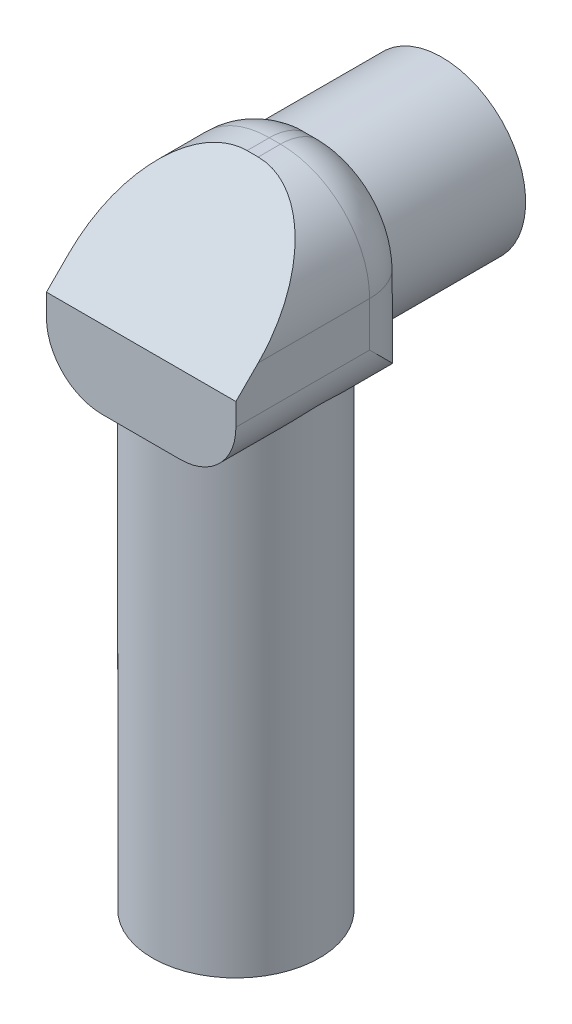
from build123d import *

# Parameters (mm, degrees)
SKETCH1_R           = 7.5
SKETCH1_R_2         = 2.4
BOSS_EXTRUDE1_DEPTH = 58
SKETCH2_W           = 17
SKETCH2_H           = 17
BOSS_EXTRUDE2_DEPTH = 17
SKETCH3_R           = 7.5
SKETCH3_R_2         = 2.4
BOSS_EXTRUDE3_DEPTH = 10
FILLET5_R           = 8
CHAMFER1_SIZE       = 10
FILLET4_R           = 5


with BuildPart() as part:
    # Sketch1 → Boss-Extrude1 (new body)
    with BuildSketch(Plane(origin=(0, 0, 0), x_dir=(1, 0, 0), z_dir=(0, 1, 0))):
        with Locations(Location((0, 0, 0), (0, 0, 90))):
            Circle(SKETCH1_R)
        with Locations(Location((0, 0, 0), (0, 0, 90))):
            Circle(SKETCH1_R_2, mode=Mode.SUBTRACT)
    extrude(amount=BOSS_EXTRUDE1_DEPTH)

    # Sketch2 → Boss-Extrude2 (add)
    with BuildSketch(Plane(origin=(0, 58, 0), x_dir=(1, 0, 0), z_dir=(0, 1, 0))):
        Rectangle(SKETCH2_W, SKETCH2_H)
    extrude(amount=-BOSS_EXTRUDE2_DEPTH)

    # Sketch3 → Boss-Extrude3 (add)
    with BuildSketch(Plane(origin=(0, 0, -8.5), x_dir=(-1, 0, 0), z_dir=(0, 0, -1))):
        with Locations((0, 49.5)):
            Circle(SKETCH3_R)
        with Locations((0, 49.5)):
            Circle(SKETCH3_R_2, mode=Mode.SUBTRACT)
    extrude(amount=BOSS_EXTRUDE3_DEPTH)

    # Fillet5
    fillet5_edges = [part.edges().sort_by_distance(p)[0] for p in [
        (8.5, 58, 0),
        (-8.5, 58, 0),
    ]]
    fillet(fillet5_edges, radius=FILLET5_R)

    # Chamfer1
    # the kernel refuses this chamfer: 10 mm, written as the material it takes off along each edge
    with BuildSketch(Plane(origin=(26.21682988, 58, 8.5), x_dir=(0, 0.027495876610586317, -0.9996219169112968), z_dir=(-1, 0, 0))) as chamfer1_piece_1:
        Polygon((CHAMFER1_SIZE * 0.999621916911, CHAMFER1_SIZE * 0.0274958766106), (-CHAMFER1_SIZE * 0.0274958766106, CHAMFER1_SIZE * 0.999621916911), (0, 0), align=None)
    extrude(amount=52.433659759, mode=Mode.SUBTRACT)

    # Fillet4
    # the kernel refuses this fillet: 5 mm, written as the material it takes off along each edge
    with BuildSketch(Plane(origin=(-8.5, 50, -8.5), x_dir=(1, 0, 0), z_dir=(0, -1, 0))) as fillet4_piece_1_section:
        with BuildLine():
            CenterArc((FILLET4_R, FILLET4_R), FILLET4_R, 180, 90)
            Line((0, FILLET4_R), (0, 0))
            Line((0, 0), (FILLET4_R, 0))
        make_face()
    fillet4_piece_1 = extrude(amount=21.5, mode=Mode.PRIVATE)
    fillet4_piece_1 = fillet4_piece_1 - Plane(origin=(0, 49.5, -7.300599215), x_dir=(-1, 0, 0), z_dir=(0, 0, 1)) * Cylinder(7.5, 64, mode=Mode.PRIVATE)
    add(fillet4_piece_1, mode=Mode.SUBTRACT)
    with BuildSketch(Plane(origin=(8.5, 50, -8.5), x_dir=(-1, 0, 0), z_dir=(0, -1, 0))) as fillet4_piece_2_section:
        with BuildLine():
            CenterArc((FILLET4_R, -FILLET4_R), FILLET4_R, 90, 90)
            Line((0, -FILLET4_R), (0, 0))
            Line((0, 0), (FILLET4_R, 0))
        make_face()
    fillet4_piece_2 = extrude(amount=21.5, mode=Mode.PRIVATE)
    fillet4_piece_2 = fillet4_piece_2 - Plane(origin=(0, 49.5, -7.300599064), x_dir=(-1, 0, 0), z_dir=(0, 0, 1)) * Cylinder(7.5, 63, mode=Mode.PRIVATE)
    add(fillet4_piece_2, mode=Mode.SUBTRACT)
    with BuildSketch(Plane(origin=(8.5, 41, -21), x_dir=(-1, 0, 0), z_dir=(0, 0, 1))) as fillet4_piece_3_section:
        with BuildLine():
            CenterArc((FILLET4_R, -FILLET4_R), FILLET4_R, 90, 90)
            Line((0, -FILLET4_R), (0, 0))
            Line((0, 0), (FILLET4_R, 0))
        make_face()
    fillet4_piece_3 = extrude(amount=42, mode=Mode.PRIVATE)
    fillet4_piece_3 = fillet4_piece_3 - Plane(origin=(0, 41.109676193, 0), x_dir=(0, 0, -1), z_dir=(0, -1, 0)) * Cylinder(7.5, 104, mode=Mode.PRIVATE)
    add(fillet4_piece_3, mode=Mode.SUBTRACT)
    with BuildSketch(Plane(origin=(-8.5, 41, 21), x_dir=(0, 1, 0), z_dir=(0, 0, -1))) as fillet4_piece_4_section:
        with BuildLine():
            CenterArc((FILLET4_R, FILLET4_R), FILLET4_R, 180, 90)
            Line((0, FILLET4_R), (0, 0))
            Line((0, 0), (FILLET4_R, 0))
        make_face()
    fillet4_piece_4 = extrude(amount=42, mode=Mode.PRIVATE)
    fillet4_piece_4 = fillet4_piece_4 - Plane(origin=(0, 44.689641685, 0), x_dir=(0, 0, -1), z_dir=(0, -1, 0)) * Cylinder(7.5, 104, mode=Mode.PRIVATE)
    add(fillet4_piece_4, mode=Mode.SUBTRACT)
    with BuildSketch(Plane(origin=(0.5, 50, -8.5), x_dir=(1, 0, 0), z_dir=(0, -1, 0))) as fillet4_piece_5_section:
        with BuildLine():
            CenterArc((8 - FILLET4_R, FILLET4_R), FILLET4_R, 270, 90)
            Line((8, FILLET4_R), (8, 0))
            Line((8, 0), (8 - FILLET4_R, 0))
        make_face()
    fillet4_piece_5 = revolve(axis=Axis((0.5, 50, -8.5), (0, 0, 1)), revolution_arc=90, mode=Mode.PRIVATE)
    fillet4_piece_5 = fillet4_piece_5 - Plane(origin=(0, 49.5, -6.88973409), x_dir=(-1, 0, 0), z_dir=(0, 0, 1)) * Cylinder(7.5, 33, mode=Mode.PRIVATE)
    add(fillet4_piece_5, mode=Mode.SUBTRACT)
    with BuildSketch(Plane(origin=(-0.5, 58, -8.5), x_dir=(0, -1, 0), z_dir=(1, 0, 0))) as fillet4_piece_6_section:
        with BuildLine():
            CenterArc((FILLET4_R, -FILLET4_R), FILLET4_R, 90, 90)
            Line((0, -FILLET4_R), (0, 0))
            Line((0, 0), (FILLET4_R, 0))
        make_face()
    fillet4_piece_6 = extrude(amount=1, mode=Mode.PRIVATE)
    fillet4_piece_6 = fillet4_piece_6 - Plane(origin=(0, 49.5, -6.859352055), x_dir=(-1, 0, 0), z_dir=(0, 0, 1)) * Cylinder(7.5, 23, mode=Mode.PRIVATE)
    add(fillet4_piece_6, mode=Mode.SUBTRACT)
    with BuildSketch(Plane(origin=(-0.5, 50, -8.5), x_dir=(-1, 0, 0), z_dir=(0, -1, 0))) as fillet4_piece_7_section:
        with BuildLine():
            CenterArc((8 - FILLET4_R, -FILLET4_R), FILLET4_R, 0, 90)
            Line((8, -FILLET4_R), (8, 0))
            Line((8, 0), (8 - FILLET4_R, 0))
        make_face()
    fillet4_piece_7 = revolve(axis=Axis((-0.5, 50, -8.5), (0, 0, -1)), revolution_arc=90, mode=Mode.PRIVATE)
    fillet4_piece_7 = fillet4_piece_7 - Plane(origin=(0, 49.5, -6.889734089), x_dir=(-1, 0, 0), z_dir=(0, 0, 1)) * Cylinder(7.5, 32, mode=Mode.PRIVATE)
    add(fillet4_piece_7, mode=Mode.SUBTRACT)


solid = part.part
